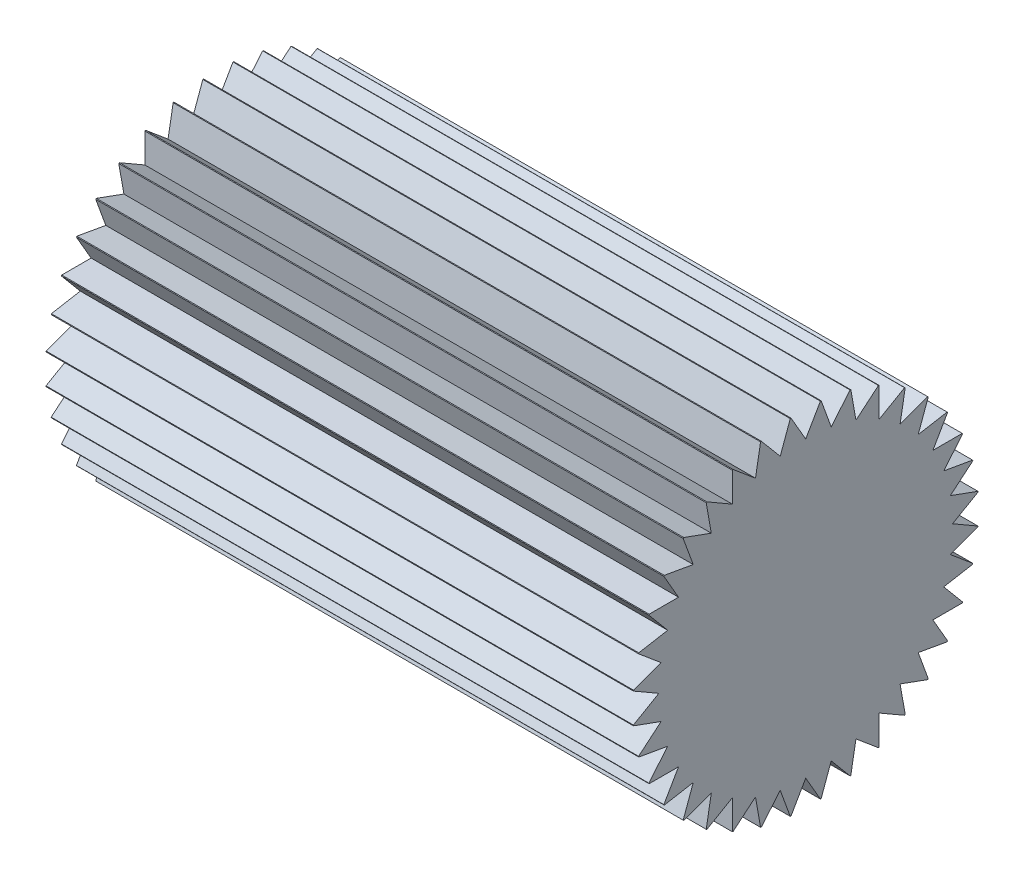
from build123d import *

# Parameters (mm, degrees)
BOSS_EXTRUDE1_DEPTH = 40


with BuildPart() as part:
    # Sketch1 → Boss-Extrude1 (new body)
    with BuildSketch(Plane(origin=(0, 0, 0), x_dir=(0, 0, -1), z_dir=(1, 0, 0))):
        with BuildLine():
            Line((-1, 11.732050808), (0, 10))
            Line((0, 10), (1, 11.732050808))
            ThreePointArc((1, 11.732050808), (1.026223309, 11.729786097), (1.05244149, 11.727462772))
            Line((1.05244149, 11.727462772), (1.736481777, 9.84807753))
            Line((1.736481777, 9.84807753), (3.022056996, 11.380166416))
            ThreePointArc((3.022056996, 11.380166416), (3.047488651, 11.373382482), (3.072905078, 11.366541714))
            Line((3.072905078, 11.366541714), (3.420201433, 9.396926208))
            Line((3.420201433, 9.396926208), (4.952290319, 10.682501427))
            ThreePointArc((4.952290319, 10.682501427), (4.976157593, 10.671404395), (5, 10.660254038))
            Line((5, 10.660254038), (5, 8.660254038))
            Line((5, 8.660254038), (6.732050808, 9.660254038))
            ThreePointArc((6.732050808, 9.660254038), (6.753628504, 9.645181086), (6.775172452, 9.630059937))
            Line((6.775172452, 9.630059937), (6.427876097, 7.660444431))
            Line((6.427876097, 7.660444431), (8.307261338, 8.344484718))
            ThreePointArc((8.307261338, 8.344484718), (8.32589383, 8.32589383), (8.344484718, 8.307261338))
            Line((8.344484718, 8.307261338), (7.660444431, 6.427876097))
            Line((7.660444431, 6.427876097), (9.630059937, 6.775172452))
            ThreePointArc((9.630059937, 6.775172452), (9.645181086, 6.753628504), (9.660254038, 6.732050808))
            Line((9.660254038, 6.732050808), (8.660254038, 5))
            Line((8.660254038, 5), (10.660254038, 5))
            ThreePointArc((10.660254038, 5), (10.671404395, 4.976157593), (10.682501427, 4.952290319))
            Line((10.682501427, 4.952290319), (9.396926208, 3.420201433))
            Line((9.396926208, 3.420201433), (11.366541714, 3.072905078))
            ThreePointArc((11.366541714, 3.072905078), (11.373382482, 3.047488651), (11.380166416, 3.022056996))
            Line((11.380166416, 3.022056996), (9.84807753, 1.736481777))
            Line((9.84807753, 1.736481777), (11.727462772, 1.05244149))
            ThreePointArc((11.727462772, 1.05244149), (11.729786097, 1.026223309), (11.732050808, 1))
            Line((11.732050808, 1), (10, 0))
            Line((10, 0), (11.732050808, -1))
            ThreePointArc((11.732050808, -1), (11.729786097, -1.026223309), (11.727462772, -1.05244149))
            Line((11.727462772, -1.05244149), (9.84807753, -1.736481777))
            Line((9.84807753, -1.736481777), (11.380166416, -3.022056996))
            ThreePointArc((11.380166416, -3.022056996), (11.373382482, -3.047488651), (11.366541714, -3.072905078))
            Line((11.366541714, -3.072905078), (9.396926208, -3.420201433))
            Line((9.396926208, -3.420201433), (10.682501427, -4.952290319))
            ThreePointArc((10.682501427, -4.952290319), (10.671404395, -4.976157593), (10.660254038, -5))
            Line((10.660254038, -5), (8.660254038, -5))
            Line((8.660254038, -5), (9.660254038, -6.732050808))
            ThreePointArc((9.660254038, -6.732050808), (9.645181086, -6.753628504), (9.630059937, -6.775172452))
            Line((9.630059937, -6.775172452), (7.660444431, -6.427876097))
            Line((7.660444431, -6.427876097), (8.344484718, -8.307261338))
            ThreePointArc((8.344484718, -8.307261338), (8.32589383, -8.32589383), (8.307261338, -8.344484718))
            Line((8.307261338, -8.344484718), (6.427876097, -7.660444431))
            Line((6.427876097, -7.660444431), (6.775172452, -9.630059937))
            ThreePointArc((6.775172452, -9.630059937), (6.753628504, -9.645181086), (6.732050808, -9.660254038))
            Line((6.732050808, -9.660254038), (5, -8.660254038))
            Line((5, -8.660254038), (5, -10.660254038))
            ThreePointArc((5, -10.660254038), (4.976157593, -10.671404395), (4.952290319, -10.682501427))
            Line((4.952290319, -10.682501427), (3.420201433, -9.396926208))
            Line((3.420201433, -9.396926208), (3.072905078, -11.366541714))
            ThreePointArc((3.072905078, -11.366541714), (3.047488651, -11.373382482), (3.022056996, -11.380166416))
            Line((3.022056996, -11.380166416), (1.736481777, -9.84807753))
            Line((1.736481777, -9.84807753), (1.05244149, -11.727462772))
            ThreePointArc((1.05244149, -11.727462772), (1.026223309, -11.729786097), (1, -11.732050808))
            Line((1, -11.732050808), (0, -10))
            Line((0, -10), (-1, -11.732050808))
            ThreePointArc((-1, -11.732050808), (-1.026223309, -11.729786097), (-1.05244149, -11.727462772))
            Line((-1.05244149, -11.727462772), (-1.736481777, -9.84807753))
            Line((-1.736481777, -9.84807753), (-3.022056996, -11.380166416))
            ThreePointArc((-3.022056996, -11.380166416), (-3.047488651, -11.373382482), (-3.072905078, -11.366541714))
            Line((-3.072905078, -11.366541714), (-3.420201433, -9.396926208))
            Line((-3.420201433, -9.396926208), (-4.952290319, -10.682501427))
            ThreePointArc((-4.952290319, -10.682501427), (-4.976157593, -10.671404395), (-5, -10.660254038))
            Line((-5, -10.660254038), (-5, -8.660254038))
            Line((-5, -8.660254038), (-6.732050808, -9.660254038))
            ThreePointArc((-6.732050808, -9.660254038), (-6.753628504, -9.645181086), (-6.775172452, -9.630059937))
            Line((-6.775172452, -9.630059937), (-6.427876097, -7.660444431))
            Line((-6.427876097, -7.660444431), (-8.307261338, -8.344484718))
            ThreePointArc((-8.307261338, -8.344484718), (-8.32589383, -8.32589383), (-8.344484718, -8.307261338))
            Line((-8.344484718, -8.307261338), (-7.660444431, -6.427876097))
            Line((-7.660444431, -6.427876097), (-9.630059937, -6.775172452))
            ThreePointArc((-9.630059937, -6.775172452), (-9.645181086, -6.753628504), (-9.660254038, -6.732050808))
            Line((-9.660254038, -6.732050808), (-8.660254038, -5))
            Line((-8.660254038, -5), (-10.660254038, -5))
            ThreePointArc((-10.660254038, -5), (-10.671404395, -4.976157593), (-10.682501427, -4.952290319))
            Line((-10.682501427, -4.952290319), (-9.396926208, -3.420201433))
            Line((-9.396926208, -3.420201433), (-11.366541714, -3.072905078))
            ThreePointArc((-11.366541714, -3.072905078), (-11.373382482, -3.047488651), (-11.380166416, -3.022056996))
            Line((-11.380166416, -3.022056996), (-9.84807753, -1.736481777))
            Line((-9.84807753, -1.736481777), (-11.727462772, -1.05244149))
            ThreePointArc((-11.727462772, -1.05244149), (-11.729786097, -1.026223309), (-11.732050808, -1))
            Line((-11.732050808, -1), (-10, 0))
            Line((-10, 0), (-11.732050808, 1))
            ThreePointArc((-11.732050808, 1), (-11.729786097, 1.026223309), (-11.727462772, 1.05244149))
            Line((-11.727462772, 1.05244149), (-9.84807753, 1.736481777))
            Line((-9.84807753, 1.736481777), (-11.380166416, 3.022056996))
            ThreePointArc((-11.380166416, 3.022056996), (-11.373382482, 3.047488651), (-11.366541714, 3.072905078))
            Line((-11.366541714, 3.072905078), (-9.396926208, 3.420201433))
            Line((-9.396926208, 3.420201433), (-10.682501427, 4.952290319))
            ThreePointArc((-10.682501427, 4.952290319), (-10.671404395, 4.976157593), (-10.660254038, 5))
            Line((-10.660254038, 5), (-8.660254038, 5))
            Line((-8.660254038, 5), (-9.660254038, 6.732050808))
            ThreePointArc((-9.660254038, 6.732050808), (-9.645181086, 6.753628504), (-9.630059937, 6.775172452))
            Line((-9.630059937, 6.775172452), (-7.660444431, 6.427876097))
            Line((-7.660444431, 6.427876097), (-8.344484718, 8.307261338))
            ThreePointArc((-8.344484718, 8.307261338), (-8.32589383, 8.32589383), (-8.307261338, 8.344484718))
            Line((-8.307261338, 8.344484718), (-6.427876097, 7.660444431))
            Line((-6.427876097, 7.660444431), (-6.775172452, 9.630059937))
            ThreePointArc((-6.775172452, 9.630059937), (-6.753628504, 9.645181086), (-6.732050808, 9.660254038))
            Line((-6.732050808, 9.660254038), (-5, 8.660254038))
            Line((-5, 8.660254038), (-5, 10.660254038))
            ThreePointArc((-5, 10.660254038), (-4.976157593, 10.671404395), (-4.952290319, 10.682501427))
            Line((-4.952290319, 10.682501427), (-3.420201433, 9.396926208))
            Line((-3.420201433, 9.396926208), (-3.072905078, 11.366541714))
            ThreePointArc((-3.072905078, 11.366541714), (-3.047488651, 11.373382482), (-3.022056996, 11.380166416))
            Line((-3.022056996, 11.380166416), (-1.736481777, 9.84807753))
            Line((-1.736481777, 9.84807753), (-1.05244149, 11.727462772))
            ThreePointArc((-1.05244149, 11.727462772), (-1.026223309, 11.729786097), (-1, 11.732050808))
        make_face()
    extrude(amount=BOSS_EXTRUDE1_DEPTH)


solid = part.part
